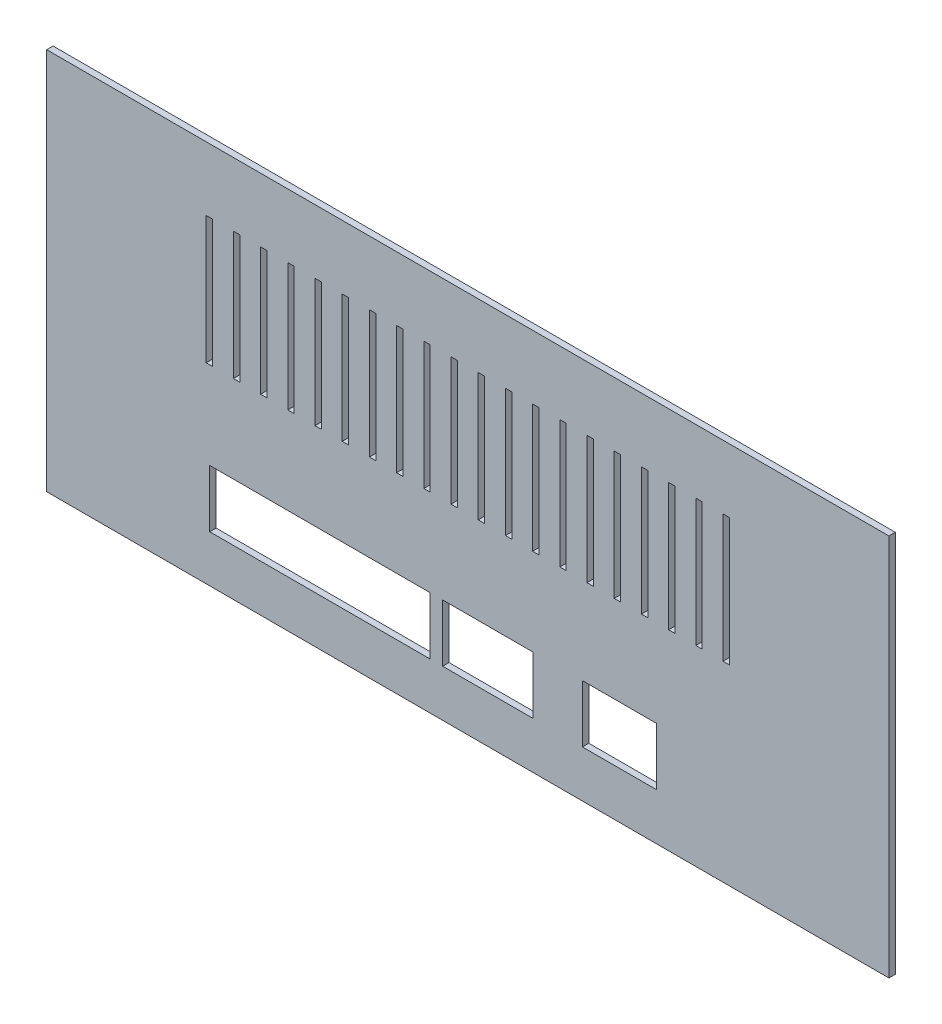
from build123d import *

# Parameters (mm, degrees)
SKETCH1_W           = 132
SKETCH1_H           = 60
BOSS_EXTRUDE1_DEPTH = 1
SKETCH4_W           = 11.62
SKETCH4_H           = 9
SKETCH4_W_2         = 14.16
SKETCH4_W_3         = 34.5
CUT_EXTRUDE3_DEPTH  = 93.665256257
SKETCH11_W          = 1
SKETCH11_H          = 20
CUT_EXTRUDE6_DEPTH  = 93.665256257


with BuildPart() as part:
    # Sketch1 → Boss-Extrude1 (new body)
    with BuildSketch(Plane.XY):
        with Locations((17.755849622, 9.633412311)):
            Rectangle(SKETCH1_W, SKETCH1_H)
    extrude(amount=BOSS_EXTRUDE1_DEPTH)

    # Sketch4 → Cut-Extrude3 (cut, through all)
    with BuildSketch(Plane(origin=(0, 0, 0), x_dir=(-1, 0, 0), z_dir=(0, 0, -1))):
        with Locations((-41.525849622, -8.521305626)):
            Rectangle(SKETCH4_W, SKETCH4_H)
        with Locations((-20.885849622, -8.521305626)):
            Rectangle(SKETCH4_W_2, SKETCH4_H)
        with Locations((5.444150378, -8.521305626)):
            Rectangle(SKETCH4_W_3, SKETCH4_H)
    extrude(amount=-CUT_EXTRUDE3_DEPTH, mode=Mode.SUBTRACT)

    # Sketch11 → Cut-Extrude6 (cut, through all)
    with BuildSketch(Plane(origin=(0, 0, 0), x_dir=(-1, 0, 0), z_dir=(0, 0, -1))):
        with Locations((-53.992691727, 19.633412311)):
            Rectangle(SKETCH11_W, SKETCH11_H)
        with Locations((-58.255849622, 19.633412311)):
            Rectangle(SKETCH11_W, SKETCH11_H)
        with Locations((-49.729533832, 19.633412311)):
            Rectangle(SKETCH11_W, SKETCH11_H)
        with Locations((-45.466375937, 19.633412311)):
            Rectangle(SKETCH11_W, SKETCH11_H)
        with Locations((-41.203218043, 19.633412311)):
            Rectangle(SKETCH11_W, SKETCH11_H)
        with Locations((-36.940060148, 19.633412311)):
            Rectangle(SKETCH11_W, SKETCH11_H)
        with Locations((-32.676902253, 19.633412311)):
            Rectangle(SKETCH11_W, SKETCH11_H)
        with Locations((-28.413744358, 19.633412311)):
            Rectangle(SKETCH11_W, SKETCH11_H)
        with Locations((-24.150586464, 19.633412311)):
            Rectangle(SKETCH11_W, SKETCH11_H)
        with Locations((-19.887428569, 19.633412311)):
            Rectangle(SKETCH11_W, SKETCH11_H)
        with Locations((-15.624270674, 19.633412311)):
            Rectangle(SKETCH11_W, SKETCH11_H)
        with Locations((-11.36111278, 19.633412311)):
            Rectangle(SKETCH11_W, SKETCH11_H)
        with Locations((-7.097954885, 19.633412311)):
            Rectangle(SKETCH11_W, SKETCH11_H)
        with Locations((-2.83479699, 19.633412311)):
            Rectangle(SKETCH11_W, SKETCH11_H)
        with Locations((1.428360905, 19.633412311)):
            Rectangle(SKETCH11_W, SKETCH11_H)
        with Locations((5.691518799, 19.633412311)):
            Rectangle(SKETCH11_W, SKETCH11_H)
        with Locations((9.954676694, 19.633412311)):
            Rectangle(SKETCH11_W, SKETCH11_H)
        with Locations((14.217834589, 19.633412311)):
            Rectangle(SKETCH11_W, SKETCH11_H)
        with Locations((18.480992484, 19.633412311)):
            Rectangle(SKETCH11_W, SKETCH11_H)
        with Locations((22.744150378, 19.633412311)):
            Rectangle(SKETCH11_W, SKETCH11_H)
    extrude(amount=-CUT_EXTRUDE6_DEPTH, mode=Mode.SUBTRACT)


solid = part.part
